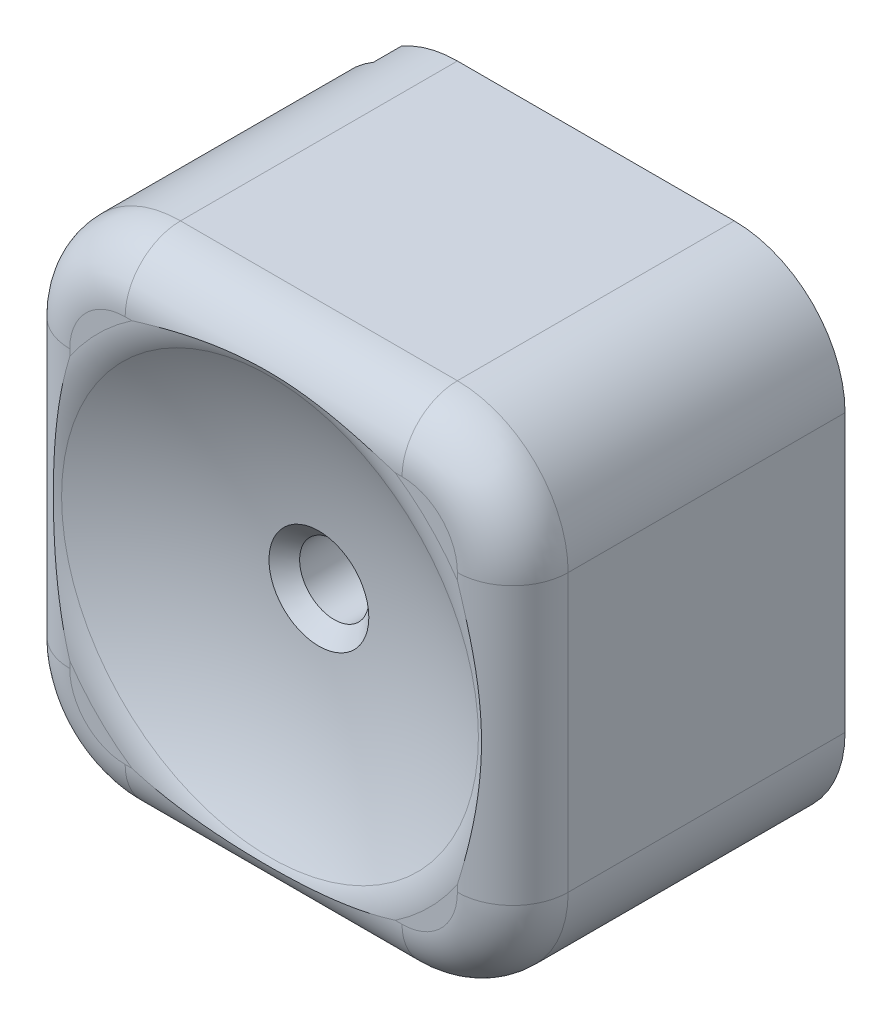
from build123d import *

# Parameters (mm, degrees)
SKETCH1_W           = 18
SKETCH1_H           = 18
BOSS_EXTRUDE1_DEPTH = 13
FILLET1_R           = 4
SKETCH2_R           = 1.25
CUT_EXTRUDE1_DEPTH  = 18
SKETCH3_R           = 6
CUT_EXTRUDE2_DEPTH  = 10
SKETCH4_R           = 5.25
CUT_EXTRUDE3_DEPTH  = 10
BOSS_EXTRUDE2_START = 6
SKETCH5_R           = 1.75
SKETCH5_R_2         = 1.25
BOSS_EXTRUDE2_DEPTH = 6
FILLET2_R           = 2
CUT_EXTRUDE4_DEPTH  = 2
SKETCH10_W          = 22.06427133
SKETCH10_H          = 21.544432477
CUT_EXTRUDE5_DEPTH  = 1
CHAMFER1_SIZE       = 0.5
CHAMFER2_SIZE       = 0.5
CHAMFER3_SIZE       = 0.5


# Some blends are built 0.0001 mm under size
with BuildPart() as part:
    # Sketch1 → Boss-Extrude1 (new body)
    with BuildSketch(Plane.XY):
        with Locations((-9, 9)):
            Rectangle(SKETCH1_W, SKETCH1_H)
    extrude(amount=BOSS_EXTRUDE1_DEPTH)

    # Fillet1
    fillet1_edges = [part.edges().sort_by_distance(p)[0] for p in [
        (0, 0, 6.5),
        (-18, 0, 6.5),
        (-18, 18, 6.5),
        (0, 18, 6.5),
    ]]
    fillet(fillet1_edges, radius=FILLET1_R)

    # Sketch2 → Cut-Extrude1 (cut)
    with BuildSketch(Plane(origin=(0, 0, 0), x_dir=(-1, 0, 0), z_dir=(0, 0, -1))):
        with Locations((9, 9)):
            Circle(SKETCH2_R)
    extrude(amount=-CUT_EXTRUDE1_DEPTH, mode=Mode.SUBTRACT)

    # Sketch3 → Cut-Extrude2 (cut)
    with BuildSketch(Plane(origin=(0, 0, 0), x_dir=(-1, 0, 0), z_dir=(0, 0, -1))):
        with BuildLine():
            Line((1, 14), (1, 4))
            ThreePointArc((1, 4), (1.878679656, 1.878679656), (4, 1))
            Line((4, 1), (14, 1))
            ThreePointArc((14, 1), (16.121320344, 1.878679656), (17, 4))
            Line((17, 4), (17, 14))
            ThreePointArc((17, 14), (16.121320344, 16.121320344), (14, 17))
            Line((14, 17), (4, 17))
            ThreePointArc((4, 17), (1.878679656, 16.121320344), (1, 14))
        make_face()
        with Locations((9, 9)):
            Circle(SKETCH3_R, mode=Mode.SUBTRACT)
    extrude(amount=-CUT_EXTRUDE2_DEPTH, mode=Mode.SUBTRACT)

    # Sketch4 → Cut-Extrude3 (cut)
    with BuildSketch(Plane(origin=(0, 0, 0), x_dir=(-1, 0, 0), z_dir=(0, 0, -1))):
        with Locations((9, 9)):
            Circle(SKETCH4_R)
    extrude(amount=-CUT_EXTRUDE3_DEPTH, mode=Mode.SUBTRACT)

    # Sketch5 → Boss-Extrude2 (add)
    with BuildSketch(Plane(origin=(0, 0, 10), x_dir=(-1, 0, 0), z_dir=(0, 0, -1)).offset(BOSS_EXTRUDE2_START)):
        with Locations((9, 9)):
            Circle(SKETCH5_R)
        with Locations((9, 9)):
            Circle(SKETCH5_R_2, mode=Mode.SUBTRACT)
    extrude(amount=-BOSS_EXTRUDE2_DEPTH)

    # Sketch7 → Cut-Revolve4 (revolve, cut)
    with BuildSketch(Plane(origin=(0, 9, 0), x_dir=(1, 0, 0), z_dir=(0, 1, 0))):
        with BuildLine():
            Line((-9, -10.9), (-9, -43.1))
            ThreePointArc((-9, -43.1), (7.1, -27), (-9, -10.9))
        make_face()
    revolve(axis=Axis((-9, 9, 0), (0, 0, 1)), mode=Mode.SUBTRACT)

    # Fillet2
    # the kernel refuses this fillet: 2 mm, written as the material it takes off along each edge
    with BuildSketch(Plane(origin=(0, 14, 13), x_dir=(-1, 0, 0), z_dir=(0, -1, 0)), Plane(origin=(-14, 18, 13), x_dir=(0, -1, 0), z_dir=(1, 0, 0)), Plane(origin=(-18, 4, 13), x_dir=(1, 0, 0), z_dir=(0, 1, 0))) as fillet2_piece_1:
        with BuildLine():
            CenterArc((FILLET2_R, FILLET2_R), FILLET2_R, 180, 90)
            Line((0, FILLET2_R), (0, 0))
            Line((0, 0), (FILLET2_R, 0))
        make_face()
    extrude(amount=10, mode=Mode.SUBTRACT)
    with BuildSketch(Plane(origin=(-4, 0, 13), x_dir=(0, 0, -1), z_dir=(-1, 0, 0))) as fillet2_piece_2:
        with BuildLine():
            CenterArc((FILLET2_R, -FILLET2_R), FILLET2_R, 90, 90)
            Line((0, -FILLET2_R), (0, 0))
            Line((0, 0), (FILLET2_R, 0))
        make_face()
    extrude(amount=10, mode=Mode.SUBTRACT)
    with BuildSketch(Plane(origin=(-4, 14, 13), x_dir=(0, 1, 0), z_dir=(-1, 0, 0))) as fillet2_piece_3:
        with BuildLine():
            CenterArc((4 - FILLET2_R, FILLET2_R), FILLET2_R, 270, 90)
            Line((4, FILLET2_R), (4, 0))
            Line((4, 0), (4 - FILLET2_R, 0))
        make_face()
    revolve(axis=Axis((-4, 14, 13), (0, 0, -1)), revolution_arc=90, mode=Mode.SUBTRACT)
    with BuildSketch(Plane(origin=(-14, 14, 13), x_dir=(-1, 0, 0), z_dir=(0, -1, 0))) as fillet2_piece_4:
        with BuildLine():
            CenterArc((4 - FILLET2_R, FILLET2_R), FILLET2_R, 270, 90)
            Line((4, FILLET2_R), (4, 0))
            Line((4, 0), (4 - FILLET2_R, 0))
        make_face()
    revolve(axis=Axis((-14, 14, 13), (0, 0, -1)), revolution_arc=90, mode=Mode.SUBTRACT)
    with BuildSketch(Plane(origin=(-14, 4, 13), x_dir=(0, -1, 0), z_dir=(1, 0, 0))) as fillet2_piece_5:
        with BuildLine():
            CenterArc((4 - FILLET2_R, FILLET2_R), FILLET2_R, 270, 90)
            Line((4 - FILLET2_R, 0), (4, 0))
            Line((4, 0), (4, FILLET2_R))
        make_face()
    revolve(axis=Axis((-14, 4, 13), (0, 0, -1)), revolution_arc=90, mode=Mode.SUBTRACT)
    with BuildSketch(Plane(origin=(-4, 4, 13), x_dir=(0, -1, 0), z_dir=(-1, 0, 0))) as fillet2_piece_6:
        with BuildLine():
            CenterArc((4 - FILLET2_R, -FILLET2_R), FILLET2_R, 0, 90)
            Line((4 - FILLET2_R, 0), (4, 0))
            Line((4, 0), (4, -FILLET2_R))
        make_face()
    revolve(axis=Axis((-4, 4, 13), (0, 0, 1)), revolution_arc=90, mode=Mode.SUBTRACT)
    with BuildSketch(Plane(origin=(-9, 9, 13), x_dir=(1, 0, 0), z_dir=(0, 1, 0))) as fillet2_piece_7:
        with BuildLine():
            CenterArc((8.462269199, 2), FILLET2_R, 242.126002653, 27.873997347)
            ThreePointArc((7.527211829, 0.232044199), (7.73971142, 0.117608407), (7.950471684, 0))
            Line((7.950471684, 0), (8.462269199, 0))
        make_face()
    revolve(axis=Axis((-9, 9, 13), (0, 0, -1)), mode=Mode.SUBTRACT)

    # Sketch9 → Cut-Extrude4 (cut)
    with BuildSketch(Plane(origin=(0, 0, 0), x_dir=(-1, 0, 0), z_dir=(0, 0, -1))):
        with BuildLine():
            Line((16.707106781, 15.292893219), (17.445719569, 16.031506006))
            ThreePointArc((17.445719569, 16.031506006), (16.828427125, 16.828427125), (16.031506006, 17.445719569))
            Line((16.031506006, 17.445719569), (15.292893219, 16.707106781))
            ThreePointArc((15.292893219, 16.707106781), (16.121320344, 16.121320344), (16.707106781, 15.292893219))
        make_face()
    extrude(amount=-CUT_EXTRUDE4_DEPTH, mode=Mode.SUBTRACT)

    # Sketch10 → Cut-Extrude5 (cut)
    with BuildSketch(Plane(origin=(0, 0, 0), x_dir=(-1, 0, 0), z_dir=(0, 0, -1))):
        with Locations((9.251838168, 8.653440765)):
            Rectangle(SKETCH10_W, SKETCH10_H)
    extrude(amount=-CUT_EXTRUDE5_DEPTH, mode=Mode.SUBTRACT)

    # Chamfer1
    chamfer1_edges = [part.edges().sort_by_distance(p)[0] for p in [
        (-1, 9, 1),
        (-1.878679656, 16.121320344, 1),
        (-9, 17, 1),
        (-14.662827148, 16.925860587, 1),
        (-16.925860587, 14.662827148, 1),
        (-17, 9, 1),
        (-16.121320344, 1.878679656, 1),
        (-9, 1, 1),
        (-1.878679656, 1.878679656, 1),
        (-3, 9, 1),
    ]]
    chamfer(chamfer1_edges, length=CHAMFER1_SIZE)

    # Chamfer2
    chamfer2_edges = [part.edges().sort_by_distance(p)[0] for p in [
        (-7.75, 9, 4),
    ]]
    chamfer(chamfer2_edges, length=CHAMFER2_SIZE - 0.0001)  # a hair under: the kernel refuses the full size

    # Chamfer3
    # the kernel refuses this chamfer: 0.543867406, 0.5 mm, written as the material it takes off along each edge
    with BuildSketch(Plane(origin=(-9, 9, 10.948598192), x_dir=(-1, 0, 0), z_dir=(0, -1, 0))) as chamfer3_piece_1:
        with BuildLine():
            Line((1.25, CHAMFER3_SIZE), (1.802636138, -0.052636138))
            ThreePointArc((1.802636138, -0.052636138), (1.534897868, -0.024733766), (1.25, 0))
            Line((1.25, 0), (1.25, CHAMFER3_SIZE))
        make_face()
    revolve(axis=Axis((-9, 9, 10.948598192), (0, 0, -1)), revolution_arc=180, mode=Mode.SUBTRACT)
    with BuildSketch(Plane(origin=(-9, 9, 10.948598192), x_dir=(1, 0, 0), z_dir=(0, 1, 0))) as chamfer3_piece_2:
        with BuildLine():
            Line((1.25, CHAMFER3_SIZE), (1.802636138, -0.052636138))
            ThreePointArc((1.802636138, -0.052636138), (1.534897868, -0.024733766), (1.25, 0))
            Line((1.25, 0), (1.25, CHAMFER3_SIZE))
        make_face()
    revolve(axis=Axis((-9, 9, 10.948598192), (0, 0, -1)), revolution_arc=180, mode=Mode.SUBTRACT)


solid = part.part
